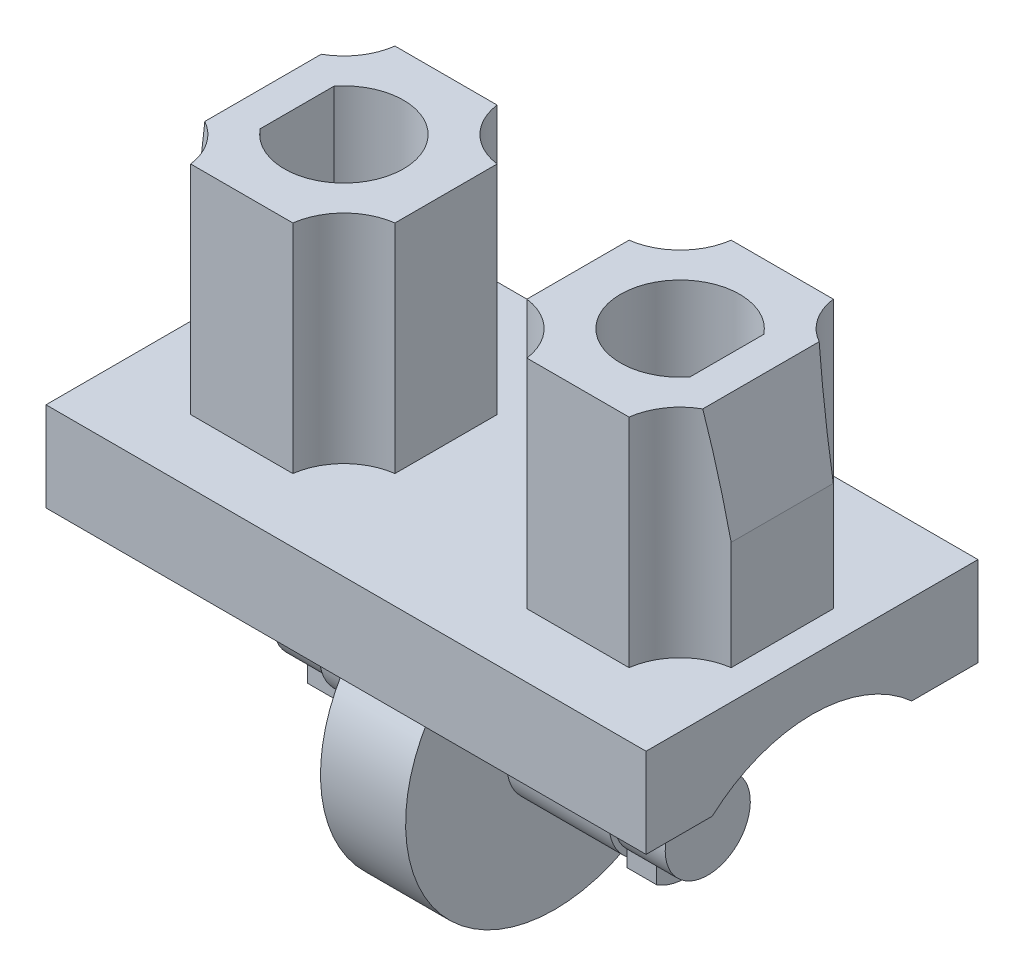
from build123d import *

# Parameters (mm, degrees)
BOSS_EXTRUDE2_DEPTH  = 7.05
SKETCH2_4_R          = 3.5
BOSS_EXTRUDE3_DEPTH  = 1
SKETCH6_R            = 1.12
BOSS_EXTRUDE4_DEPTH  = 2.4
SKETCH7_R            = 1
BOSS_EXTRUDE5_DEPTH  = 1.2
CUT_EXTRUDE1_START   = -1.2
CUT_EXTRUDE1_DEPTH   = 1.2
BOSS_EXTRUDE6_DEPTH  = 0.7
BOSS_EXTRUDE7_DEPTH  = 5.1
CUT_EXTRUDE2_DEPTH   = 4.8
CUT_EXTRUDE3_DEPTH   = 13.515290648
MIRROR10_START       = -4.6
MIRROR10_DEPTH       = 3.6
MIRROR10_START_2     = -3.4
MIRROR10_2_OUTLINE_R = 1.12
MIRROR10_2_DEPTH     = 2.4
MIRROR10_START_3     = -4.1
MIRROR10_3_DEPTH     = 0.7


# Read off the part's stored shape, not the designer's step: Mirror10
with BuildPart() as part:
    # Sketch2 → Boss-Extrude2 (new, symmetric)
    with BuildSketch(Plane(origin=(0, 0, 0), x_dir=(0, 0, -1), z_dir=(1, 0, 0))):
        with BuildLine():
            ThreePointArc((-2.343074903, -2.1), (0, -1.2), (2.343074903, -2.1))
            Line((2.343074903, -2.1), (3.9, -2.1))
            Line((3.9, -2.1), (3.9, 0))
            Line((3.9, 0), (-3.9, 0))
            Line((-3.9, 0), (-3.9, -2.1))
            Line((-3.9, -2.1), (-2.343074903, -2.1))
        make_face()
    extrude(amount=BOSS_EXTRUDE2_DEPTH, both=True)

    # Sketch2<4> → Boss-Extrude3 (add, symmetric)
    with BuildSketch(Plane(origin=(0, 0, 0), x_dir=(0, 0, -1), z_dir=(1, 0, 0))):
        with Locations((0, -4.7)):
            Circle(SKETCH2_4_R)
    extrude(amount=BOSS_EXTRUDE3_DEPTH, both=True)

    # Sketch6 → Boss-Extrude4 (add)
    with BuildSketch(Plane(origin=(1, 0, 0), x_dir=(0, 0, -1), z_dir=(1, 0, 0))):
        with Locations((0, -4.7)):
            Circle(SKETCH6_R)
    extrude(amount=BOSS_EXTRUDE4_DEPTH)

    # Sketch7 → Boss-Extrude5 (add)
    with BuildSketch(Plane(origin=(3.4, 0, 0), x_dir=(0, 0, -1), z_dir=(1, 0, 0))):
        with Locations((0, -4.7)):
            Circle(SKETCH7_R)
    extrude(amount=BOSS_EXTRUDE5_DEPTH)

    # Sketch8 → Cut-Extrude1 (cut)
    with BuildSketch(Plane(origin=(4.6, 0, 0), x_dir=(0, 0, -1), z_dir=(1, 0, 0)).offset(CUT_EXTRUDE1_START)):
        with BuildLine():
            ThreePointArc((0.661437828, -3.95), (0, -3.7), (-0.661437828, -3.95))
            Line((-0.661437828, -3.95), (0.661437828, -3.95))
        make_face()
    extrude(amount=CUT_EXTRUDE1_DEPTH, mode=Mode.SUBTRACT)

    # Sketch12 → Boss-Extrude7 (add)
    with BuildSketch(Plane(origin=(0, 0, 0), x_dir=(1, 0, 0), z_dir=(0, 1, 0))):
        with BuildLine():
            ThreePointArc((1.55, -1.2), (2.352548706, -1.597451294), (2.75, -2.4))
            Line((2.75, -2.4), (5.15, -2.4))
            ThreePointArc((5.15, -2.4), (5.547451294, -1.597451294), (6.35, -1.2))
            Line((6.35, -1.2), (6.35, 1.2))
            ThreePointArc((6.35, 1.2), (5.547451294, 1.597451294), (5.15, 2.4))
            Line((5.15, 2.4), (2.75, 2.4))
            ThreePointArc((2.75, 2.4), (2.352548706, 1.597451294), (1.55, 1.2))
            Line((1.55, 1.2), (1.55, -1.2))
        make_face()
    boss_extrude7 = extrude(amount=BOSS_EXTRUDE7_DEPTH)

    # Sketch13 → Cut-Extrude2 (cut)
    with BuildSketch(Plane(origin=(0, 5.1, 0), x_dir=(1, 0, 0), z_dir=(0, 1, 0))):
        with BuildLine():
            Line((5.05, 0.866025404), (5.05, -0.866025404))
            ThreePointArc((5.05, -0.866025404), (2.55, 0), (5.05, 0.866025404))
        make_face()
    cut_extrude2 = extrude(amount=-CUT_EXTRUDE2_DEPTH, mode=Mode.SUBTRACT)

    # Sketch16 → Cut-Extrude3 (cut, through all)
    with BuildSketch(Plane.XY.offset(2.4)):
        Polygon((5.85, 5.1), (6.35, 5.1), (6.35, 2.55), align=None)
    cut_extrude3 = extrude(amount=-CUT_EXTRUDE3_DEPTH, mode=Mode.SUBTRACT)

    # Mirror6: Boss-Extrude7, Cut-Extrude2 across plane
    add(boss_extrude7.mirror(Plane(origin=(0, 0, 0), x_dir=(0, 0, 1), z_dir=(1, 0, 0))))
    add(cut_extrude2.mirror(Plane(origin=(0, 0, 0), x_dir=(0, 0, 1), z_dir=(1, 0, 0))), mode=Mode.SUBTRACT)

    # Mirror9: Cut-Extrude3 across plane
    add(cut_extrude3.mirror(Plane(origin=(0, 0, 0), x_dir=(0, 0, 1), z_dir=(1, 0, 0))), mode=Mode.SUBTRACT)

    # Mirror10 outline → Mirror10 (add)
    with BuildSketch(Plane.YZ.offset(MIRROR10_START)):
        with BuildLine():
            ThreePointArc((-3.95, 0.661437828), (-5.7, 0), (-3.95, -0.661437828))
            Line((-3.95, -0.661437828), (-3.95, 0.661437828))
        make_face()
    extrude(amount=MIRROR10_DEPTH)

    # Mirror10 2 outline → Mirror10 2 (add)
    with BuildSketch(Plane.YZ.offset(MIRROR10_START_2)):
        with Locations((-4.7, 0)):
            Circle(MIRROR10_2_OUTLINE_R)
        with BuildLine():
            ThreePointArc((-3.95, -0.661437828), (-5.7, 0), (-3.95, 0.661437828))
            Line((-3.95, 0.661437828), (-3.95, -0.661437828))
        make_face(mode=Mode.SUBTRACT)
    extrude(amount=MIRROR10_2_DEPTH)

    # Mirror10 3 outline → Mirror10 3 (add)
    with BuildSketch(Plane.YZ.offset(MIRROR10_START_3)):
        with BuildLine():
            Line((-5.414142843, 0.7), (-5.794142843, 0.7))
            ThreePointArc((-5.794142843, 0.7), (-5.99890283, 0), (-5.794142843, -0.7))
            Line((-5.794142843, -0.7), (-5.414142843, -0.7))
            ThreePointArc((-5.414142843, -0.7), (-5.7, 0), (-5.414142843, 0.7))
        make_face()
    extrude(amount=MIRROR10_3_DEPTH)


with BuildPart() as body_2:
    # Sketch10 → Boss-Extrude6 (new body)
    with BuildSketch(Plane(origin=(3.4, 0, 0), x_dir=(0, 0, -1), z_dir=(1, 0, 0))):
        with BuildLine():
            Line((0, -5.82), (0, -5.7))
            ThreePointArc((0, -5.7), (-0.378058962, -5.625781519), (-0.7, -5.414142843))
            Line((-0.7, -5.414142843), (-0.7, -5.57429972))
            ThreePointArc((-0.7, -5.57429972), (-0.370934168, -5.756791296), (0, -5.82))
        make_face()
        with BuildLine():
            ThreePointArc((0.7, -5.414142843), (0.378058962, -5.625781519), (0, -5.7))
            Line((0, -5.7), (0, -5.82))
            ThreePointArc((0, -5.82), (0.370934168, -5.756791296), (0.7, -5.57429972))
            Line((0.7, -5.57429972), (0.7, -5.414142843))
        make_face()
        with BuildLine():
            ThreePointArc((0.7, -5.57429972), (0.370934168, -5.756791296), (0, -5.82))
            Line((0, -5.82), (0, -5.99890283))
            ThreePointArc((0, -5.99890283), (0.364666509, -5.946662303), (0.7, -5.794142843))
            Line((0.7, -5.794142843), (0.7, -5.57429972))
        make_face()
        with BuildLine():
            Line((0, -5.99890283), (0, -5.82))
            ThreePointArc((0, -5.82), (-0.370934168, -5.756791296), (-0.7, -5.57429972))
            Line((-0.7, -5.57429972), (-0.7, -5.794142843))
            ThreePointArc((-0.7, -5.794142843), (-0.364666509, -5.946662303), (0, -5.99890283))
        make_face()
    extrude(amount=BOSS_EXTRUDE6_DEPTH)


solid = Compound([part.part, body_2.part])
